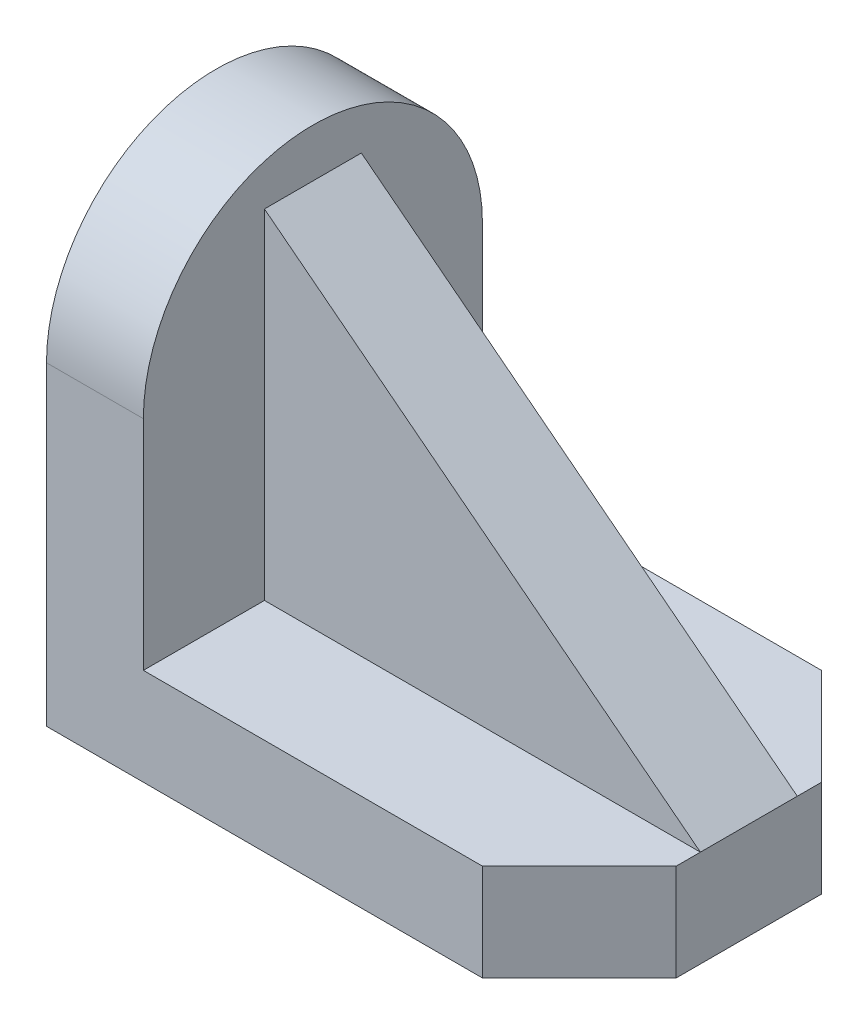
from build123d import *

# Parameters (mm, degrees)
SKETCH1_W           = 660
SKETCH1_H           = 420
BOSS_EXTRUDE1_DEPTH = 120
SKETCH2_W           = 120
SKETCH2_H           = 420
BOSS_EXTRUDE2_DEPTH = 480
FILLET1_RADIUS      = 210
FILLET1_LENGTH      = 120
CHAMFER1_START      = 376.454614173
CHAMFER1_OUTLINE_W  = 172
CHAMFER1_OUTLINE_H  = 120
CHAMFER1_DEPTH      = 85.545385827
CHAMFER2_START      = 616.17299772
CHAMFER2_OUTLINE_W  = 173
CHAMFER2_OUTLINE_H  = 120
CHAMFER2_DEPTH      = 85.82700228
SKETCH4_W           = 120
SKETCH4_H           = 420
BOSS_EXTRUDE3_DEPTH = 540
CUT_EXTRUDE1_DEPTH  = 480


with BuildPart() as part:
    # Sketch1 → Boss-Extrude1 (new body)
    with BuildSketch(Plane(origin=(0, 0, 0), x_dir=(1, 0, 0), z_dir=(0, 1, 0))):
        with Locations((281.893715562, 169.506494581)):
            Rectangle(SKETCH1_W, SKETCH1_H)
    extrude(amount=BOSS_EXTRUDE1_DEPTH)

    # Sketch2 → Boss-Extrude2 (add)
    with BuildSketch(Plane(origin=(0, 120, 0), x_dir=(1, 0, 0), z_dir=(0, 1, 0))):
        with Locations((11.893715562, 169.506494581)):
            Rectangle(SKETCH2_W, SKETCH2_H)
    extrude(amount=BOSS_EXTRUDE2_DEPTH)

    # Fillet1: full round fillet: the end face becomes a half cylinder, R = half its width
    fillet1_face = Plane((11.893715562, 600, -169.506494581), x_dir=(1, 0, 0), z_dir=(0, 1, 0))  # on the end face: x along it, z out of the body
    fillet1_slab = fillet1_face.offset(-FILLET1_RADIUS / 2) * Box(FILLET1_LENGTH, 2 * FILLET1_RADIUS, FILLET1_RADIUS, mode=Mode.PRIVATE)  # the body's end, R deep
    fillet1_round = Plane((11.893715562, 390, -169.506494581), x_dir=(0, 1, 0), z_dir=(1, 0, 0)) * Cylinder(FILLET1_RADIUS, FILLET1_LENGTH, mode=Mode.PRIVATE)  # its axis R under the face
    add(fillet1_slab - fillet1_round, mode=Mode.SUBTRACT)

    # Chamfer1: read off the stored shape, not the designer's step
    # Chamfer1 outline → Chamfer1 (cut)
    with BuildSketch(Plane(origin=(0, 0, 0), x_dir=(0.7071067811865471, 0, -0.707106781186548), z_dir=(0.707106781186548, 0, 0.707106781186547)).offset(CHAMFER1_START)):
        with Locations((404, 60)):
            Rectangle(CHAMFER1_OUTLINE_W, CHAMFER1_OUTLINE_H)
    extrude(amount=CHAMFER1_DEPTH, mode=Mode.SUBTRACT)

    # Chamfer2: read off the stored shape, not the designer's step
    # Chamfer2 outline → Chamfer2 (cut)
    with BuildSketch(Plane(origin=(0, 0, 0), x_dir=(0.707106781186548, 0, 0.707106781186547), z_dir=(0.707106781186547, 0, -0.707106781186548)).offset(CHAMFER2_START)):
        with Locations((164.5, -60)):
            Rectangle(CHAMFER2_OUTLINE_W, CHAMFER2_OUTLINE_H)
    extrude(amount=CHAMFER2_DEPTH, mode=Mode.SUBTRACT)

    # Sketch4 → Boss-Extrude3 (add)
    with BuildSketch(Plane(origin=(71.893715562, 0, 0), x_dir=(0, 0, -1), z_dir=(1, 0, 0))):
        with Locations((169.506494581, 330)):
            Rectangle(SKETCH4_W, SKETCH4_H)
    extrude(amount=BOSS_EXTRUDE3_DEPTH)

    # Sketch7 → Cut-Extrude1 (cut)
    with BuildSketch(Plane.XY.offset(-109.506494581)):
        Polygon((71.893715562, 540), (611.893715562, 120), (611.893715562, 540), align=None)
    extrude(amount=-CUT_EXTRUDE1_DEPTH, mode=Mode.SUBTRACT)


solid = part.part
